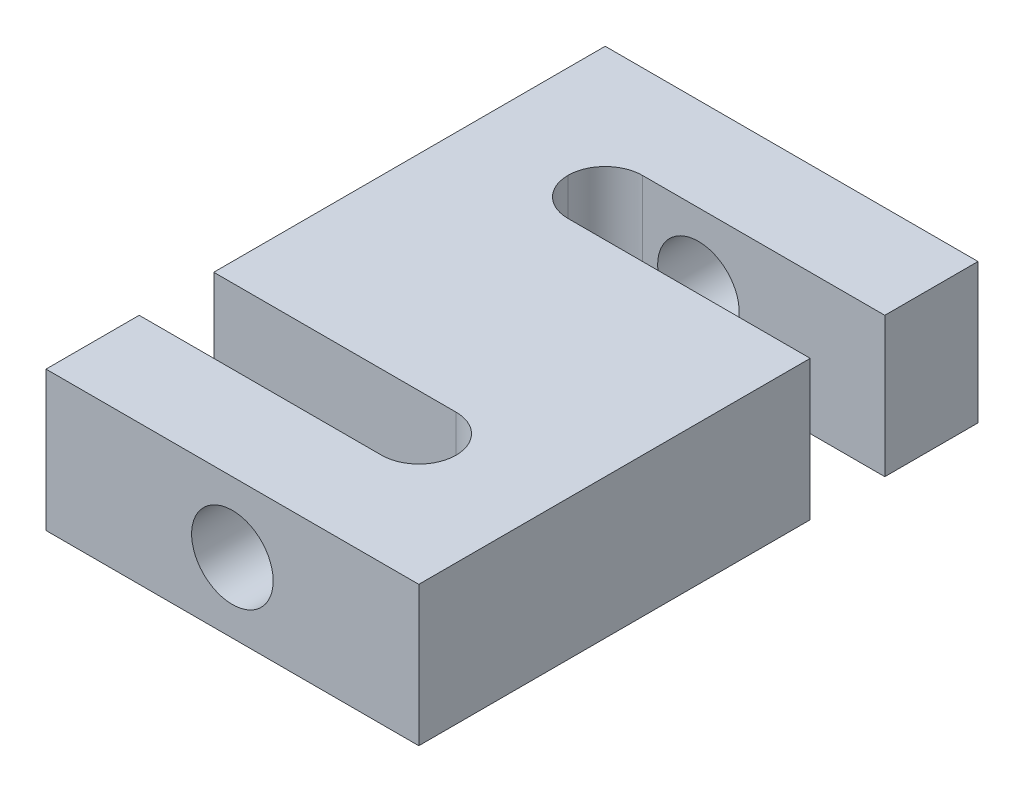
from build123d import *

# Parameters (mm, degrees)
BOSS_EXTRUDE1_DEPTH = 19.05
FILLET1_R           = 5.08
CUT_EXTRUDE1_REACH  = 84.55
SKETCH2_R           = 5.55625
CUT_EXTRUDE2_START  = -76.2
SKETCH2_2_R         = 5.55625
CUT_EXTRUDE2_DEPTH  = 12.7


with BuildPart() as part:
    # Sketch1 → Boss-Extrude1 (new body)
    with BuildSketch(Plane(origin=(0, 0, 0), x_dir=(1, 0, 0), z_dir=(0, 1, 0))):
        Polygon((-12.7, 25.4), (25.4, 25.4), (25.4, 38.1), (-25.4, 38.1), (-25.4, -15.24), (12.7, -15.24), (12.7, -25.4), (-25.4, -25.4), (-25.4, -38.1), (25.4, -38.1), (25.4, 15.24), (-12.7, 15.24), align=None)
    extrude(amount=BOSS_EXTRUDE1_DEPTH)

    # Fillet1
    fillet1_edges = [part.edges().sort_by_distance(p)[0] for p in [
        (12.7, 9.525, 25.4),
        (12.7, 9.525, 15.24),
        (-12.7, 9.525, -15.24),
        (-12.7, 9.525, -25.4),
    ]]
    fillet(fillet1_edges, radius=FILLET1_R - 0.0001)  # a hair under: the kernel refuses the full size

    # Sketch2 → Cut-Extrude1 (cut, up to next)
    with BuildSketch(Plane.XY.offset(38.1), mode=Mode.PRIVATE) as cut_extrude1_sk1:
        with Locations((0, 9.525)):
            Circle(SKETCH2_R)
    cut_extrude1_tool1 = extrude(cut_extrude1_sk1.sketch, amount=-CUT_EXTRUDE1_REACH, mode=Mode.PRIVATE) & part.part
    add(cut_extrude1_tool1.solids().sort_by_distance((0, 9.525, 38.1))[0], mode=Mode.SUBTRACT)

    # Sketch2<2> → Cut-Extrude2 (cut)
    with BuildSketch(Plane.XY.offset(38.1).offset(CUT_EXTRUDE2_START)):
        with Locations((0, 9.525)):
            Circle(SKETCH2_2_R)
    extrude(amount=CUT_EXTRUDE2_DEPTH, mode=Mode.SUBTRACT)


solid = part.part
